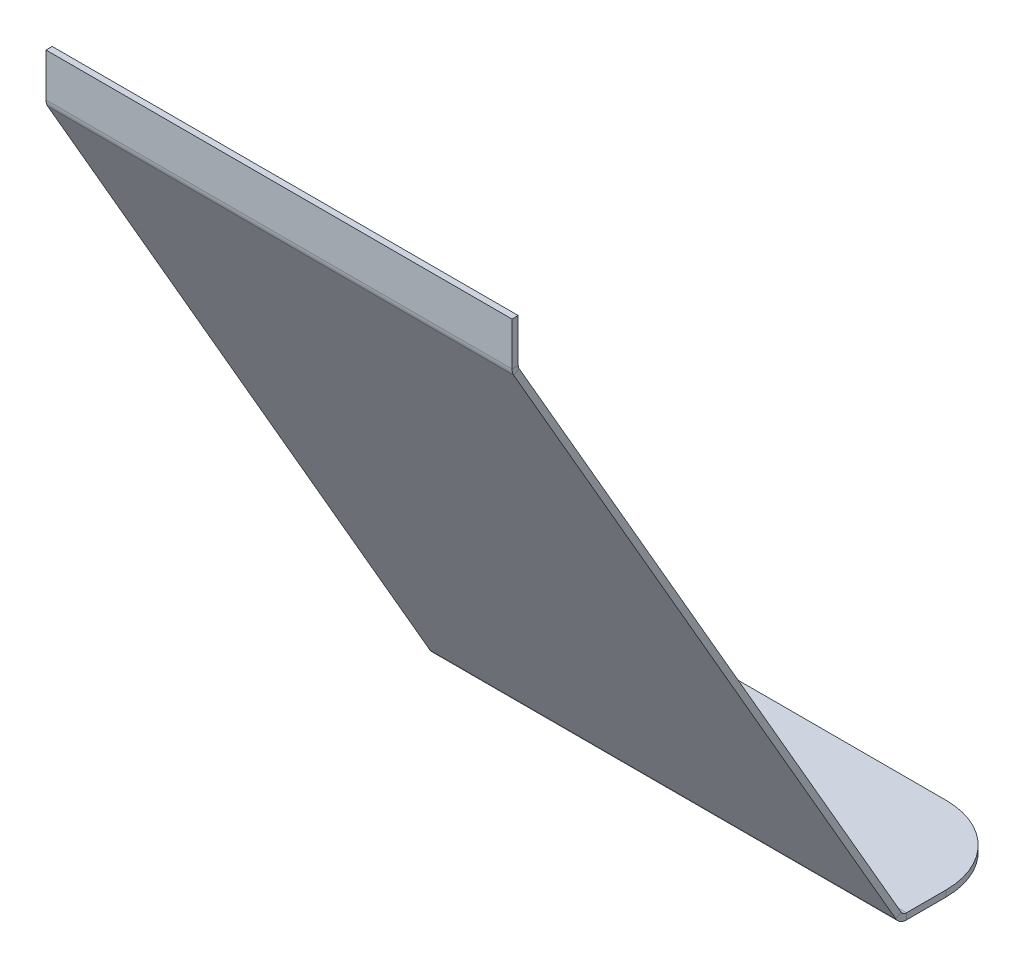
from build123d import *

# Parameters (mm, degrees)
BOSS_EXTRUDE1_DEPTH          = 30
EDGE_FLANGE1_DEPTH           = 30
EDGE_FLANGE1_2_DEPTH         = 30
EDGE_FLANGE2_STRIP_CUT_DEPTH = 30
EDGE_FLANGE2_DEPTH           = 30
SKETCH12_R                   = 1.55
CUT_EXTRUDE1_DEPTH           = 61.278165958
FILLET1_R                    = 5


# Read off the part's stored shape, not the designer's step: Edge-Flange1
# Sheet-metal steps are written as plain solids
with BuildPart() as part:
    # Sketch1 → Boss-Extrude1 (new body)
    with BuildSketch(Plane(origin=(0, 0, 0), x_dir=(0, 0, -1), z_dir=(1, 0, 0))):
        Polygon((-24.826638925, 43.401), (-25.173049087, 43.201), (-0.173205081, -0.1), (0.173205081, 0.1), align=None)
    extrude(amount=BOSS_EXTRUDE1_DEPTH)

    # Edge-Flange1 outline → Edge-Flange1 (cut)
    with BuildSketch(Plane.YZ):
        with BuildLine():
            Line((-0.1, 0.173205081), (0.1, -0.173205081))
            ThreePointArc((0.1, -0.173205081), (0.207179677, 0.226794919), (0.5, 0.519615242))
            Line((0.5, 0.519615242), (-0.1, 0.173205081))
        make_face()
    extrude(amount=EDGE_FLANGE1_DEPTH, mode=Mode.SUBTRACT)

    # Edge-Flange1 2 outline → Edge-Flange1 2 (add)
    with BuildSketch(Plane.YZ):
        with BuildLine():
            Line((0.7, 0.173205081), (0.1, -0.173205081))
            Line((0.1, -0.173205081), (0.1, -7.711324865))
            Line((0.1, -7.711324865), (0.5, -7.711324865))
            Line((0.5, -7.711324865), (0.5, -0.173205081))
            ThreePointArc((0.5, -0.173205081), (0.553589838, 0.026794919), (0.7, 0.173205081))
        make_face()
    extrude(amount=EDGE_FLANGE1_2_DEPTH)

    # Edge-Flange2 strip (across the edge) → Edge-Flange2 strip cut (cut)
    with BuildSketch(Plane(origin=(0, 43.401, 24.826638925), x_dir=(0, 0, -1), z_dir=(1, 0, 0))):
        Polygon((-1.492820323, 1.785640646), (-0.292820323, -0.292820323), (0.053589838, -0.092820323), (-1.146410162, 1.985640646), align=None)
    extrude(amount=EDGE_FLANGE2_STRIP_CUT_DEPTH, mode=Mode.SUBTRACT)

    # Edge-Flange2 section (across the edge) → Edge-Flange2 (add)
    with BuildSketch(Plane(origin=(0, 43.401, 24.826638925), x_dir=(0, 0, -1), z_dir=(1, 0, 0))):
        with BuildLine():
            Line((-0.4, 0.107179677), (-0.4, 2.892820323))
            Line((-0.4, 2.892820323), (0, 2.892820323))
            Line((0, 2.892820323), (0, 0.107179677))
            ThreePointArc((0, 0.107179677), (0.013629669, 0.003652059), (0.053589838, -0.092820323))
            Line((0.053589838, -0.092820323), (-0.292820323, -0.292820323))
            ThreePointArc((-0.292820323, -0.292820323), (-0.372740661, -0.099875559), (-0.4, 0.107179677))
        make_face()
    extrude(amount=EDGE_FLANGE2_DEPTH)

    # Sketch12 → Cut-Extrude1 (cut, through all)
    with BuildSketch(Plane(origin=(0, 0.5, 0), x_dir=(1, 0, 0), z_dir=(0, 1, 0))):
        with Locations(Location((15, 4.057735027, 0), (0, 0, 270))):
            Circle(SKETCH12_R)
    extrude(amount=-CUT_EXTRUDE1_DEPTH, mode=Mode.SUBTRACT)

    # Fillet1
    fillet1_edges = [part.edges().sort_by_distance(p)[0] for p in [
        (30, 0.3, -7.711324865),
        (0, 0.3, -7.711324865),
    ]]
    fillet(fillet1_edges, radius=FILLET1_R)


solid = part.part
